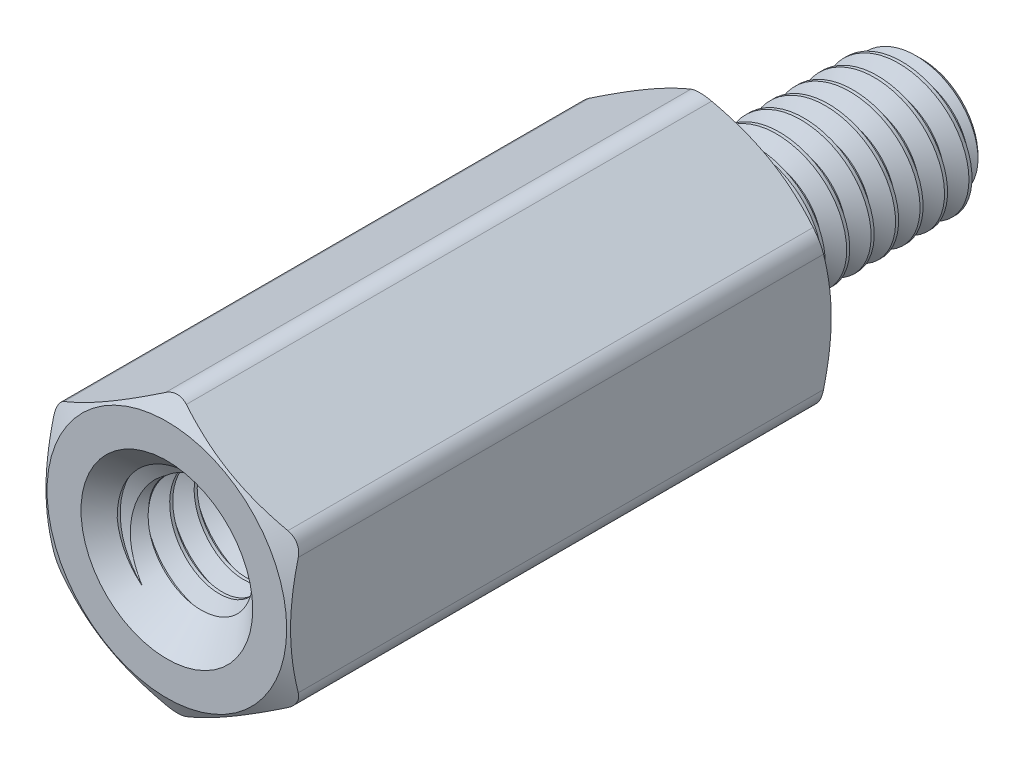
from build123d import *

# Parameters (mm, degrees)
SKETCH4_R           = 1.75
BOSS_EXTRUDE1_DEPTH = 10
SKETCH5_OUTSIDE_W   = 62.666
SKETCH5_OUTSIDE_H   = 63.362
SKETCH5_OUTSIDE_R   = 2.205
CUT_EXTRUDE1_DEPTH  = 15.318606776
CUT_EXTRUDE1_DRAFT  = -60
SKETCH6_OUTSIDE_W   = 49.696
SKETCH6_OUTSIDE_H   = 50.392
SKETCH6_OUTSIDE_R   = 2.205
CUT_EXTRUDE2_DEPTH  = 11.574142991
CUT_EXTRUDE2_DRAFT  = -60
FILLET1_R           = 0.3825
CUT_SWEEP1_PITCH    = 0.45
SKETCH9_R           = 1.475
BOSS_EXTRUDE2_DEPTH = 4.8
SKETCH10_W          = 4.8
SKETCH10_H          = 1.25
CUT_SWEEP2_PITCH    = 0.45


with BuildPart() as part:
    # Sketch3 → Revolve1 (revolve)
    with BuildSketch(Plane(origin=(0, 0, 0), x_dir=(0, 0, -1), z_dir=(1, 0, 0))):
        with BuildLine():
            Line((-5.2, 1.025), (-5.2, 0))
            Line((-5.2, 0), (3.9, 0))
            Line((3.9, 0), (3.9, 1.025))
            Line((3.9, 1.025), (3.675, 1.25))
            Line((3.675, 1.25), (0.63675, 1.25))
            Line((0.63675, 1.25), (0.468, 0.957716426))
            Line((0.468, 0.957716426), (0.225, 0.957716426))
            ThreePointArc((0.225, 0.957716426), (0.065900974, 1.0236174), (0, 1.182716426))
            Line((0, 1.182716426), (0, 2.25))
            Line((0, 2.25), (-10, 2.25))
            Line((-10, 2.25), (-10, 1.475))
            Line((-10, 1.475), (-9.775, 1.25))
            Line((-9.775, 1.25), (-5.425, 1.25))
            Line((-5.425, 1.25), (-5.2, 1.025))
        make_face()
    revolve(axis=Axis((0, 0, -3.9), (0, 0, 1)))

    # Sketch4 → Boss-Extrude1 (add)
    with BuildSketch(Plane.XY.offset(10)):
        Polygon((-2.25, 1.299038106), (-2.25, -1.299038106), (0, -2.598076211), (2.25, -1.299038106), (2.25, 1.299038106), (0, 2.598076211), align=None)
        Circle(SKETCH4_R, mode=Mode.SUBTRACT)
    extrude(amount=-BOSS_EXTRUDE1_DEPTH)


with BuildPart() as cut_extrude1_tool:
    # Sketch5 outside → Cut-Extrude1 (with draft: the straight prism first)
    with BuildSketch(Plane.XY.offset(10)):
        Rectangle(SKETCH5_OUTSIDE_W, SKETCH5_OUTSIDE_H)
        Circle(SKETCH5_OUTSIDE_R, mode=Mode.SUBTRACT)
    extrude(amount=-CUT_EXTRUDE1_DEPTH)
    # Cut-Extrude1: the draft: its side faces are tilted about the plane it starts from
    cut_extrude1_sides = [cut_extrude1_tool.faces().sort_by_distance(p)[0] for p in [
        (0, -31.681, 2.340696612),
        (31.333, 0, 2.340696612),
        (0, 31.681, 2.340696612),
        (-31.333, 0, 2.340696612),
        (-2.205, 0, 2.340696612),
    ]]
    draft(cut_extrude1_sides, Plane.XY.offset(10), CUT_EXTRUDE1_DRAFT)


with BuildPart() as part_1:
    add(part.part)

    # Cut-Extrude1: cut by cut_extrude1_tool
    add(cut_extrude1_tool.part, mode=Mode.SUBTRACT)


with BuildPart() as cut_extrude2_tool:
    # Sketch6 outside → Cut-Extrude2 (with draft: the straight prism first)
    with BuildSketch(Plane(origin=(0, 0, 0), x_dir=(-1, 0, 0), z_dir=(0, 0, -1))):
        Rectangle(SKETCH6_OUTSIDE_W, SKETCH6_OUTSIDE_H)
        Circle(SKETCH6_OUTSIDE_R, mode=Mode.SUBTRACT)
    extrude(amount=-CUT_EXTRUDE2_DEPTH)
    # Cut-Extrude2: the draft: its side faces are tilted about the plane it starts from
    cut_extrude2_sides = [cut_extrude2_tool.faces().sort_by_distance(p)[0] for p in [
        (0, -25.196, 5.787071496),
        (-24.848, 0, 5.787071496),
        (0, 25.196, 5.787071496),
        (24.848, 0, 5.787071496),
        (2.205, 0, 5.787071496),
    ]]
    draft(cut_extrude2_sides, Plane(origin=(0, 0, 0), x_dir=(-1, 0, 0), z_dir=(0, 0, -1)), CUT_EXTRUDE2_DRAFT)


with BuildPart() as part_2:
    add(part_1.part)

    # Cut-Extrude2: cut by cut_extrude2_tool
    add(cut_extrude2_tool.part, mode=Mode.SUBTRACT)

    # Fillet1
    fillet1_edges = [part_2.edges().sort_by_distance(p)[0] for p in [
        (0, 2.598076211, 5),
        (-2.25, -1.299038106, 5),
        (0, -2.598076211, 5),
        (2.25, -1.299038106, 5),
        (2.25, 1.299038106, 5),
        (-2.25, 1.299038106, 5),
    ]]
    fillet(fillet1_edges, radius=FILLET1_R)

    # Cut-Sweep1: the profile of Sketch7 profile screwed along a right-hand helix of 8.406667 turns, 6 arcs to a turn; built about Z, then put on its axis
    cut_sweep1_z = Axis((0, 0, 0), (0, 0, 1))
    cut_sweep1_corners = [(0.957416426, 0, -0.168923205), (0.957416426, 0, -0.224826795), (1.274356964, 0, -0.4078125), (1.274356964, 0, 0.0140625)]
    with BuildLine(mode=Mode.PRIVATE) as cut_sweep1_profile:
        Line(cut_sweep1_corners[0], cut_sweep1_corners[1])
        Line(cut_sweep1_corners[1], cut_sweep1_corners[2])
        Line(cut_sweep1_corners[2], cut_sweep1_corners[3])
        Line(cut_sweep1_corners[3], cut_sweep1_corners[0])
    cut_sweep1_cap = Face(cut_sweep1_profile.wire())
    cut_sweep1_turn_angles = [0, 30, 60, 90, 120, 150, 180, 210, 240, 270, 300, 330, 360]
    cut_sweep1_turn_weights = [1, 0.8660254037844387, 1, 0.8660254037844387, 1, 0.8660254037844387, 1, 0.8660254037844387, 1, 0.8660254037844387, 1, 0.8660254037844387, 1]
    cut_sweep1_turn_rails = [Edge.make_bspline([Vector(p[0], p[1], 0).rotate(cut_sweep1_z, cut_sweep1_turn_angles[k]) / cut_sweep1_turn_weights[k] + Vector(0, 0, p[2] + CUT_SWEEP1_PITCH * cut_sweep1_turn_angles[k] / 360) for k in range(13)], [0, 0, 0, 1, 1, 2, 2, 3, 3, 4, 4, 5, 5, 6, 6, 6], 2, cut_sweep1_turn_weights) for p in cut_sweep1_corners]
    cut_sweep1_turn_sides = [Face.make_surface_from_curves(cut_sweep1_turn_rails[p[0]], cut_sweep1_turn_rails[p[1]]) for p in [(0, 1), (1, 2), (2, 3), (3, 0)]]
    cut_sweep1_last_angles = [2880, 2910, 2940, 2970, 3000, 3013.2, 3026.4]
    cut_sweep1_last_weights = [1, 0.8660254037844387, 1, 0.8660254037844387, 1, 0.9735789028731565, 1]
    cut_sweep1_last_rails = [Edge.make_bspline([Vector(p[0], p[1], 0).rotate(cut_sweep1_z, cut_sweep1_last_angles[k]) / cut_sweep1_last_weights[k] + Vector(0, 0, p[2] + CUT_SWEEP1_PITCH * cut_sweep1_last_angles[k] / 360) for k in range(7)], [0, 0, 0, 1, 1, 2, 2, 3, 3, 3], 2, cut_sweep1_last_weights) for p in cut_sweep1_corners]
    cut_sweep1_last_sides = [Face.make_surface_from_curves(cut_sweep1_last_rails[p[0]], cut_sweep1_last_rails[p[1]]) for p in [(0, 1), (1, 2), (2, 3), (3, 0)]]
    cut_sweep1 = Plane(origin=(0, 0, -3.9), x_dir=(0, 1, 0), z_dir=(0, 0, 1)) * Solid(Shell([*[p.moved(Location((0, 0, CUT_SWEEP1_PITCH * i))) for i in range(8) for p in cut_sweep1_turn_sides], *cut_sweep1_last_sides, cut_sweep1_cap, cut_sweep1_cap.rotate(cut_sweep1_z, 3026.4).moved(Location((0, 0, CUT_SWEEP1_PITCH * 3026.4 / 360)))]))
    add(cut_sweep1, mode=Mode.SUBTRACT)

    # Sketch9 → Boss-Extrude2 (add)
    with BuildSketch(Plane.XY.offset(5.2)):
        Circle(SKETCH9_R)
    extrude(amount=BOSS_EXTRUDE2_DEPTH)


with BuildPart() as body_2:
    # Sketch10 → Revolve2 (revolve)
    with BuildSketch(Plane(origin=(0, 0, 0), x_dir=(0, 0, -1), z_dir=(1, 0, 0))):
        with Locations((-7.6, 0.625)):
            Rectangle(SKETCH10_W, SKETCH10_H)
    revolve(axis=Axis((0, 0, -3.9), (0, 0, 1)))

    # Cut-Sweep2: the profile of Sketch12 profile screwed along a right-hand helix of 11.666667 turns, 6 arcs to a turn; built about Z, then put on its axis
    cut_sweep2_z = Axis((0, 0, 0), (0, 0, 1))
    cut_sweep2_corners = [(0.957416426, 0, -0.224826795), (0.957416426, 0, -0.168923205), (1.274356964, 0, 0.0140625), (1.274356964, 0, -0.4078125)]
    with BuildLine(mode=Mode.PRIVATE) as cut_sweep2_profile:
        Line(cut_sweep2_corners[0], cut_sweep2_corners[1])
        Line(cut_sweep2_corners[1], cut_sweep2_corners[2])
        Line(cut_sweep2_corners[2], cut_sweep2_corners[3])
        Line(cut_sweep2_corners[3], cut_sweep2_corners[0])
    cut_sweep2_cap = Face(cut_sweep2_profile.wire())
    cut_sweep2_turn_angles = [0, 30, 60, 90, 120, 150, 180, 210, 240, 270, 300, 330, 360]
    cut_sweep2_turn_weights = [1, 0.8660254037844387, 1, 0.8660254037844387, 1, 0.8660254037844387, 1, 0.8660254037844387, 1, 0.8660254037844387, 1, 0.8660254037844387, 1]
    cut_sweep2_turn_rails = [Edge.make_bspline([Vector(p[0], p[1], 0).rotate(cut_sweep2_z, cut_sweep2_turn_angles[k]) / cut_sweep2_turn_weights[k] + Vector(0, 0, p[2] + CUT_SWEEP2_PITCH * cut_sweep2_turn_angles[k] / 360) for k in range(13)], [0, 0, 0, 1, 1, 2, 2, 3, 3, 4, 4, 5, 5, 6, 6, 6], 2, cut_sweep2_turn_weights) for p in cut_sweep2_corners]
    cut_sweep2_turn_sides = [Face.make_surface_from_curves(cut_sweep2_turn_rails[p[0]], cut_sweep2_turn_rails[p[1]]) for p in [(0, 1), (1, 2), (2, 3), (3, 0)]]
    cut_sweep2_last_angles = [3960, 3990, 4020, 4050, 4080, 4110, 4140, 4170, 4200]
    cut_sweep2_last_weights = [1, 0.8660254037844387, 1, 0.8660254037844387, 1, 0.8660254037844387, 1, 0.8660254037842641, 1]
    cut_sweep2_last_rails = [Edge.make_bspline([Vector(p[0], p[1], 0).rotate(cut_sweep2_z, cut_sweep2_last_angles[k]) / cut_sweep2_last_weights[k] + Vector(0, 0, p[2] + CUT_SWEEP2_PITCH * cut_sweep2_last_angles[k] / 360) for k in range(9)], [0, 0, 0, 1, 1, 2, 2, 3, 3, 4, 4, 4], 2, cut_sweep2_last_weights) for p in cut_sweep2_corners]
    cut_sweep2_last_sides = [Face.make_surface_from_curves(cut_sweep2_last_rails[p[0]], cut_sweep2_last_rails[p[1]]) for p in [(0, 1), (1, 2), (2, 3), (3, 0)]]
    cut_sweep2 = Plane(origin=(0, 0, 10), x_dir=(0, 1, 0), z_dir=(0, 0, -1)) * Solid(Shell([*[p.moved(Location((0, 0, CUT_SWEEP2_PITCH * i))) for i in range(11) for p in cut_sweep2_turn_sides], *cut_sweep2_last_sides, cut_sweep2_cap, cut_sweep2_cap.rotate(cut_sweep2_z, 4200).moved(Location((0, 0, CUT_SWEEP2_PITCH * 4200 / 360)))]))
    add(cut_sweep2, mode=Mode.SUBTRACT)


with BuildPart() as part_3:
    add(part_2.part)

    # Combine1: cut body 2
    add(body_2.part, mode=Mode.SUBTRACT)

    # Cut-Extrude3 cone 1 section (through the dimple's axis) → Cut-Extrude3 (revolve, cut)
    with BuildSketch(Plane(origin=(0, 0, 10), x_dir=(0, -1, 0), z_dir=(1, 0, 0))):
        Polygon((0, 0), (1.58, 0), (0, 1.58), align=None)
    revolve(axis=Axis((0, 0, 10), (0, 0, -1)), mode=Mode.SUBTRACT)


solid = part_3.part
